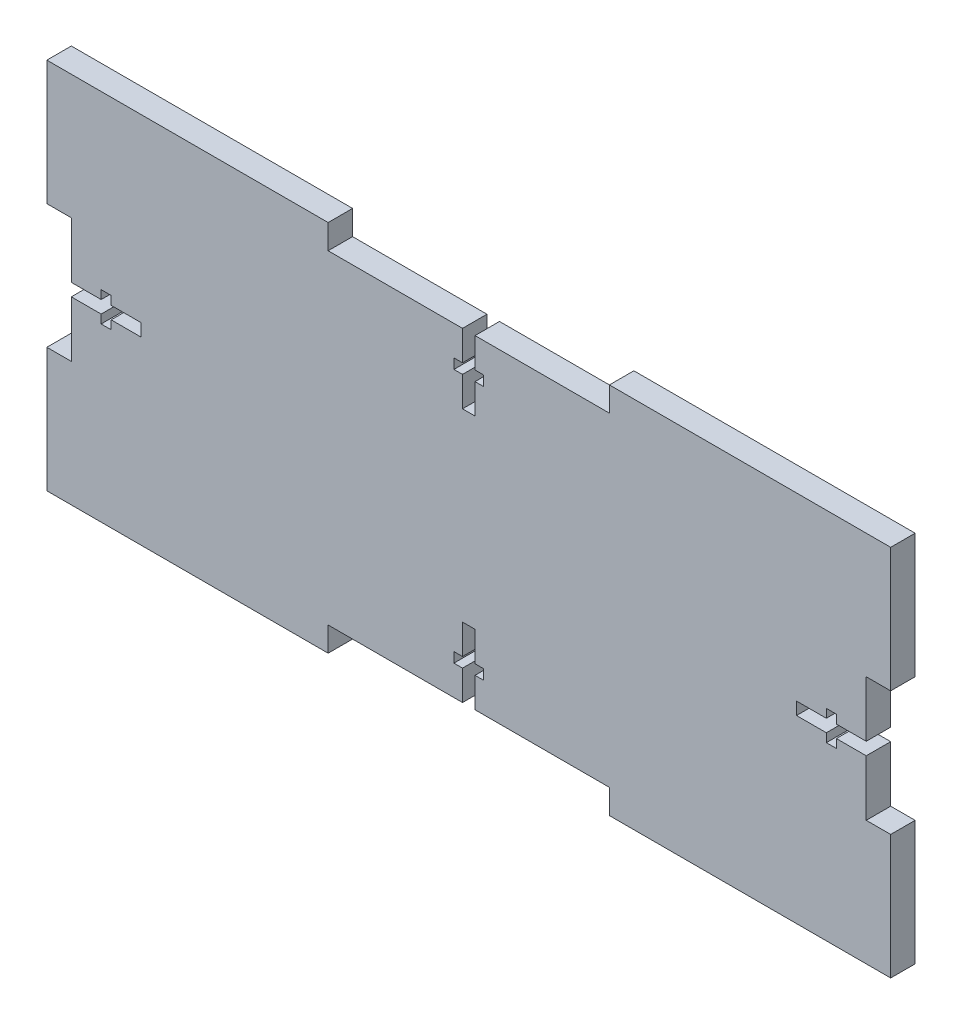
from build123d import *

# Parameters (mm, degrees)
SKETCH1_W           = 175.26
SKETCH1_H           = 77.47
BOSS_EXTRUDE1_DEPTH = 5.08
SKETCH2_W           = 58.42
SKETCH2_H           = 5.08
CUT_EXTRUDE1_DEPTH  = 96.943856109
SKETCH3_W           = 5.08
SKETCH3_H           = 25.823333334
CUT_EXTRUDE2_DEPTH  = 96.943856109
SKETCH4_W           = 14.478
SKETCH4_H           = 2.6035
CUT_EXTRUDE3_DEPTH  = 96.943856109
SKETCH5_W           = 2.6035
SKETCH5_H           = 14.478
CUT_EXTRUDE4_DEPTH  = 96.943856109
SKETCH6_W           = 6.1722
SKETCH6_H           = 2.0828
SKETCH6_W_2         = 2.0828
SKETCH6_H_2         = 6.1722
CUT_EXTRUDE5_DEPTH  = 96.943856109


with BuildPart() as part:
    # Sketch1 → Boss-Extrude1 (new body)
    with BuildSketch(Plane.XY):
        Rectangle(SKETCH1_W, SKETCH1_H)
    extrude(amount=BOSS_EXTRUDE1_DEPTH)

    # Sketch2 → Cut-Extrude1 (cut, through all)
    with BuildSketch(Plane.XY.offset(5.08)):
        with Locations((0, -36.195)):
            Rectangle(SKETCH2_W, SKETCH2_H)
        with Locations((0, 36.195)):
            Rectangle(SKETCH2_W, SKETCH2_H)
    extrude(amount=-CUT_EXTRUDE1_DEPTH, mode=Mode.SUBTRACT)

    # Sketch3 → Cut-Extrude2 (cut, through all)
    with BuildSketch(Plane.XY.offset(5.08)):
        with Locations((-85.09, 0)):
            Rectangle(SKETCH3_W, SKETCH3_H)
        with Locations((85.09, 0)):
            Rectangle(SKETCH3_W, SKETCH3_H)
    extrude(amount=-CUT_EXTRUDE2_DEPTH, mode=Mode.SUBTRACT)

    # Sketch4 → Cut-Extrude3 (cut, through all)
    with BuildSketch(Plane.XY.offset(5.08)):
        with Locations((-75.311, 0)):
            Rectangle(SKETCH4_W, SKETCH4_H)
        with Locations((75.311, 0)):
            Rectangle(SKETCH4_W, SKETCH4_H)
    extrude(amount=-CUT_EXTRUDE3_DEPTH, mode=Mode.SUBTRACT)

    # Sketch5 → Cut-Extrude4 (cut, through all)
    with BuildSketch(Plane.XY.offset(5.08)):
        with Locations((0, 26.416)):
            Rectangle(SKETCH5_W, SKETCH5_H)
        with Locations((0, -26.416)):
            Rectangle(SKETCH5_W, SKETCH5_H)
    extrude(amount=-CUT_EXTRUDE4_DEPTH, mode=Mode.SUBTRACT)

    # Sketch6 → Cut-Extrude5 (cut, through all)
    with BuildSketch(Plane.XY.offset(5.08)):
        with Locations((0, 26.416)):
            Rectangle(SKETCH6_W, SKETCH6_H)
        with Locations((0, -26.416)):
            Rectangle(SKETCH6_W, SKETCH6_H)
        with Locations((-75.311, 0)):
            Rectangle(SKETCH6_W_2, SKETCH6_H_2)
        with Locations((75.311, 0)):
            Rectangle(SKETCH6_W_2, SKETCH6_H_2)
    extrude(amount=-CUT_EXTRUDE5_DEPTH, mode=Mode.SUBTRACT)


solid = part.part
